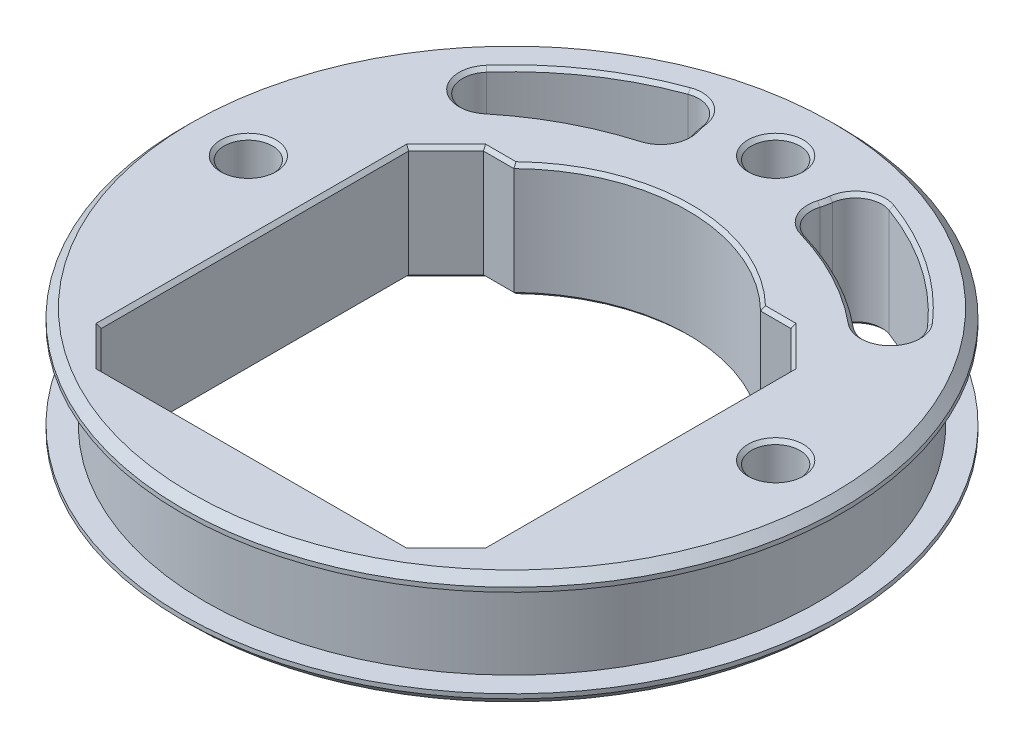
from build123d import *

# Parameters (mm, degrees)
SKETCH1_R               = 37.5
SKETCH1_R_2             = 2.75
BOSS_EXTRUDE1_DEPTH     = 6.5
SKETCH2_R               = 44.9
SKETCH2_R_2             = 34.9
CUT_EXTRUDE_THIN1_DEPTH = 5
CHAMFER1_SIZE           = 1
CHAMFER2_SIZE           = 0.4


with BuildPart() as part:
    # Sketch1 → Boss-Extrude1 (new, symmetric)
    with BuildSketch(Plane(origin=(0, 0, 0), x_dir=(1, 0, 0), z_dir=(0, 1, 0))):
        Circle(SKETCH1_R)
        with Locations((0, 30)):
            Circle(SKETCH1_R_2, mode=Mode.SUBTRACT)
        with Locations((30, 0)):
            Circle(SKETCH1_R_2, mode=Mode.SUBTRACT)
        with Locations((-30, 0)):
            Circle(SKETCH1_R_2, mode=Mode.SUBTRACT)
        with BuildLine():
            Line((-17.494426356, 14.25), (-14.033442201, 14.25))
            ThreePointArc((-14.033442201, 14.25), (0, 20), (14.033442201, 14.25))
            Line((14.033442201, 14.25), (17.494426356, 14.25))
            Line((17.494426356, 14.25), (21.75, 9.994426356))
            Line((21.75, 9.994426356), (21.75, -24.994426356))
            Line((21.75, -24.994426356), (17.494426356, -29.25))
            Line((17.494426356, -29.25), (-17.494426356, -29.25))
            Line((-17.494426356, -29.25), (-21.75, -24.994426356))
            Line((-21.75, -24.994426356), (-21.75, 9.994426356))
            Line((-21.75, 9.994426356), (-17.494426356, 14.25))
        make_face(mode=Mode.SUBTRACT)
        with BuildLine():
            ThreePointArc((7.182286097, 27.840192967), (7.335670337, 28.438609369), (7.439285619, 29.047619048))
            ThreePointArc((7.439285619, 29.047619048), (8.853359783, 31.228166276), (11.439426083, 31.486338798))
            ThreePointArc((11.439426083, 31.486338798), (18.843045333, 27.698188435), (25.085377879, 22.203013684))
            ThreePointArc((25.085377879, 22.203013684), (24.997326571, 18.131103641), (20.931054397, 17.899511222))
            ThreePointArc((20.931054397, 17.899511222), (15.388292289, 21.593722157), (9.215229657, 24.09626166))
            ThreePointArc((9.215229657, 24.09626166), (7.418794885, 25.54470973), (7.182286097, 27.840192967))
        make_face(mode=Mode.SUBTRACT)
        with BuildLine():
            ThreePointArc((-25.085377879, 22.203013684), (-24.997326571, 18.131103641), (-20.931054397, 17.899511222))
            ThreePointArc((-20.931054397, 17.899511222), (-15.388292289, 21.593722157), (-9.215229657, 24.09626166))
            ThreePointArc((-9.215229657, 24.09626166), (-7.418794885, 25.54470973), (-7.182286097, 27.840192967))
            ThreePointArc((-7.182286097, 27.840192967), (-7.335670337, 28.438609369), (-7.439285619, 29.047619048))
            ThreePointArc((-7.439285619, 29.047619048), (-8.853359783, 31.228166276), (-11.439426083, 31.486338798))
            ThreePointArc((-11.439426083, 31.486338798), (-18.843045333, 27.698188435), (-25.085377879, 22.203013684))
        make_face(mode=Mode.SUBTRACT)
    extrude(amount=BOSS_EXTRUDE1_DEPTH, both=True)

    # Sketch2 → Cut-Extrude-Thin1 (cut, symmetric)
    with BuildSketch(Plane(origin=(0, 0, 0), x_dir=(1, 0, 0), z_dir=(0, 1, 0))):
        Circle(SKETCH2_R)
        Circle(SKETCH2_R_2, mode=Mode.SUBTRACT)
    extrude(amount=CUT_EXTRUDE_THIN1_DEPTH, both=True, mode=Mode.SUBTRACT)

    # Chamfer1
    chamfer1_edges = [part.edges().sort_by_distance(p)[0] for p in [
        (-37.5, -6.5, 0),
        (-37.5, 6.5, 0),
    ]]
    chamfer(chamfer1_edges, length=CHAMFER1_SIZE)

    # Chamfer2
    chamfer2_edges = [part.edges().sort_by_distance(p)[0] for p in [
        (-15.763934278, -6.5, -14.25),
        (0, -6.5, -20),
        (15.763934278, -6.5, -14.25),
        (19.622213178, -6.5, -12.122213178),
        (21.75, -6.5, 7.5),
        (19.622213178, -6.5, 27.122213178),
        (0, -6.5, 29.25),
        (-19.622213178, -6.5, 27.122213178),
        (-21.75, -6.5, 7.5),
        (-19.622213178, -6.5, -12.122213178),
        (27.25, -6.5, 0),
        (27.25, 6.5, 0),
        (-32.75, -6.5, 0),
        (-32.75, 6.5, 0),
        (-2.75, -6.5, -30),
        (-2.75, 6.5, -30),
        (-15.388292289, 6.5, -21.593722157),
        (-7.418794885, 6.5, -25.54470973),
        (-24.997326571, 6.5, -18.131103641),
        (-7.335670337, 6.5, -28.438609369),
        (-18.843045333, 6.5, -27.698188435),
        (-8.853359783, 6.5, -31.228166276),
        (-15.388292289, -6.5, -21.593722157),
        (-7.418794885, -6.5, -25.54470973),
        (-24.997326571, -6.5, -18.131103641),
        (-7.335670337, -6.5, -28.438609369),
        (-18.843045333, -6.5, -27.698188435),
        (-8.853359783, -6.5, -31.228166276),
        (7.418794885, 6.5, -25.54470973),
        (15.388292289, 6.5, -21.593722157),
        (7.335670337, 6.5, -28.438609369),
        (24.997326571, 6.5, -18.131103641),
        (8.853359783, 6.5, -31.228166276),
        (18.843045333, 6.5, -27.698188435),
        (7.418794885, -6.5, -25.54470973),
        (15.388292289, -6.5, -21.593722157),
        (7.335670337, -6.5, -28.438609369),
        (24.997326571, -6.5, -18.131103641),
        (8.853359783, -6.5, -31.228166276),
        (18.843045333, -6.5, -27.698188435),
        (15.763934278, 6.5, -14.25),
        (19.622213178, 6.5, -12.122213178),
        (21.75, 6.5, 7.5),
        (19.622213178, 6.5, 27.122213178),
        (0, 6.5, 29.25),
        (-19.622213178, 6.5, 27.122213178),
        (-21.75, 6.5, 7.5),
        (-19.622213178, 6.5, -12.122213178),
        (0, 6.5, -20),
        (-15.763934278, 6.5, -14.25),
    ]]
    chamfer(chamfer2_edges, length=CHAMFER2_SIZE)


solid = part.part
